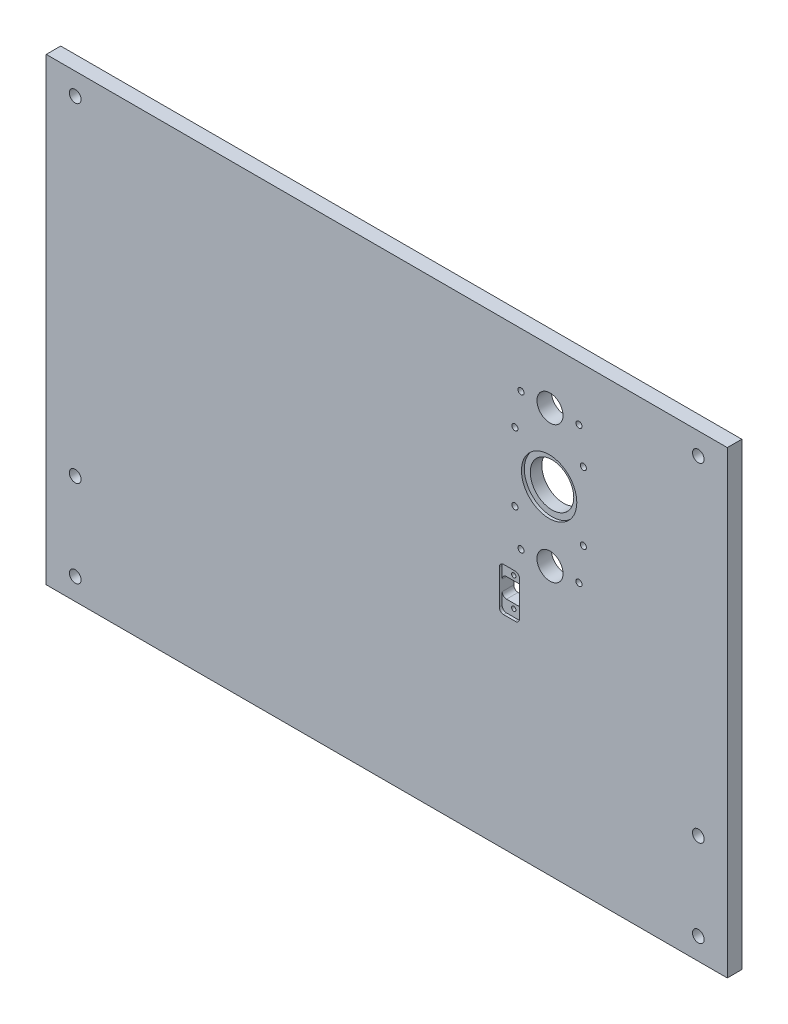
from build123d import *

# Parameters (mm, degrees)
SKETCH2_W             = 470
SKETCH2_H             = 317
BOSS_EXTRUDE1_DEPTH   = 5
SKETCH3_R             = 4.05
CUT_EXTRUDE1_DEPTH    = 10
SKETCH4_R             = 9
CUT_EXTRUDE2_DEPTH    = 284.632244288
M5X0_8_TAPPED_HOLE1_D = 4.2
SKETCH7_R             = 19.1
CUT_EXTRUDE5_DEPTH    = 2
M5X0_8_TAPPED_HOLE2_D = 4.2
SKETCH10_R            = 4
CUT_EXTRUDE8_DEPTH    = 284.632244288
SKETCH19_R            = 15
CUT_EXTRUDE10_DEPTH   = 284.568774727
SKETCH20_W            = 14
SKETCH20_H            = 30
CUT_EXTRUDE11_DEPTH   = 2
SKETCH22_R            = 1.5
CUT_EXTRUDE12_DEPTH   = 284.568774727
SKETCH23_W            = 14
SKETCH23_H            = 13.5
CUT_EXTRUDE13_DEPTH   = 284.568774727
FILLET1_R             = 3


with BuildPart() as part:
    # Sketch2 → Boss-Extrude1 (new, symmetric)
    with BuildSketch(Plane.XY):
        Rectangle(SKETCH2_W, SKETCH2_H)
    extrude(amount=BOSS_EXTRUDE1_DEPTH, both=True)

    # Sketch3 → Cut-Extrude1 (cut)
    with BuildSketch(Plane.XY.offset(5)):
        with Locations((-215, -83.5)):
            Circle(SKETCH3_R)
        with Locations((-215, -143.5)):
            Circle(SKETCH3_R)
        with Locations((215, -83.5)):
            Circle(SKETCH3_R)
        with Locations((215, -143.5)):
            Circle(SKETCH3_R)
        with Locations((-215, 143.5)):
            Circle(SKETCH3_R)
    extrude(amount=-CUT_EXTRUDE1_DEPTH, mode=Mode.SUBTRACT)

    # Sketch4 → Cut-Extrude2 (cut, through all)
    with BuildSketch(Plane.XY.offset(5)):
        with Locations((112.65, 121)):
            Circle(SKETCH4_R)
        with Locations((112.65, 26.5)):
            Circle(SKETCH4_R)
    extrude(amount=-CUT_EXTRUDE2_DEPTH, mode=Mode.SUBTRACT)

    # M5x0.8 Tapped Hole1 (through all)
    with Locations(Plane.XY.offset(5)):
        with Locations((132.65, 121), (92.65, 121), (92.65, 26.5), (132.65, 26.5)):
            Hole(M5X0_8_TAPPED_HOLE1_D / 2)

    # Sketch7 → Cut-Extrude5 (cut)
    with BuildSketch(Plane.XY.offset(5)):
        with Locations((112.05, 73.75)):
            Circle(SKETCH7_R)
    extrude(amount=-CUT_EXTRUDE5_DEPTH, mode=Mode.SUBTRACT)

    # M5x0.8 Tapped Hole2 (through all)
    with Locations(Plane.XY.offset(5)):
        with Locations((88.45, 97.35), (135.65, 97.35), (135.65, 50.15), (88.45, 50.15)):
            Hole(M5X0_8_TAPPED_HOLE2_D / 2)

    # Sketch10 → Cut-Extrude8 (cut, through all)
    with BuildSketch(Plane.XY.offset(5)):
        with Locations((215, 143.5)):
            Circle(SKETCH10_R)
    extrude(amount=-CUT_EXTRUDE8_DEPTH, mode=Mode.SUBTRACT)

    # Sketch19 → Cut-Extrude10 (cut, through all)
    with BuildSketch(Plane.XY.offset(3)):
        with Locations((112.05, 73.75)):
            Circle(SKETCH19_R)
    extrude(amount=-CUT_EXTRUDE10_DEPTH, mode=Mode.SUBTRACT)

    # Sketch20 → Cut-Extrude11 (cut)
    with BuildSketch(Plane.XY.offset(5)):
        with Locations((84.65, -3.5)):
            Rectangle(SKETCH20_W, SKETCH20_H)
    extrude(amount=-CUT_EXTRUDE11_DEPTH, mode=Mode.SUBTRACT)

    # Sketch22 → Cut-Extrude12 (cut, through all)
    with BuildSketch(Plane.XY.offset(3)):
        with Locations((85.65, 6.5)):
            Circle(SKETCH22_R)
        with Locations((85.65, -13.5)):
            Circle(SKETCH22_R)
    extrude(amount=-CUT_EXTRUDE12_DEPTH, mode=Mode.SUBTRACT)

    # Sketch23 → Cut-Extrude13 (cut, through all)
    with BuildSketch(Plane.XY.offset(3)):
        with Locations((84.65, -3.5)):
            Rectangle(SKETCH23_W, SKETCH23_H)
    extrude(amount=-CUT_EXTRUDE13_DEPTH, mode=Mode.SUBTRACT)

    # Fillet1
    fillet1_edges = [part.edges().sort_by_distance(p)[0] for p in [
        (91.65, -18.5, 4),
        (77.65, -18.5, 4),
        (77.65, 11.5, 4),
        (91.65, 11.5, 4),
        (77.65, -10.25, -1),
        (77.65, 3.25, -1),
        (91.65, 3.25, -1),
        (91.65, -10.25, -1),
    ]]
    fillet(fillet1_edges, radius=FILLET1_R)


solid = part.part
